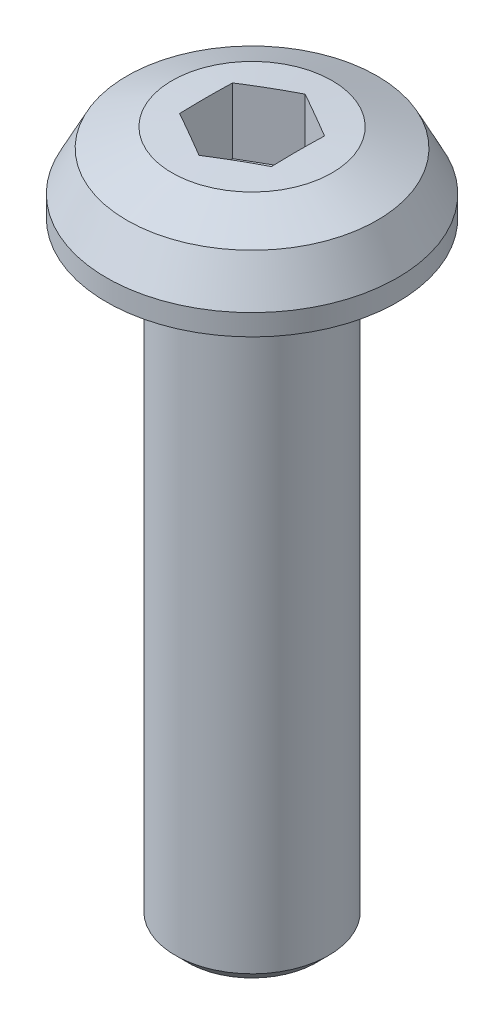
from build123d import *

# Parameters (mm, degrees)
CUT_EXTRUDE1_DEPTH = 2.25


with BuildPart() as part:
    # Sketch1 → Revolve1 (revolve)
    with BuildSketch(Plane.XY):
        Polygon((0, -20), (2.1, -20), (2.5, -19.6), (2.5, 0), (4.75, 0), (4.75, 0.6875), (4.085, 1.98), (2.6125, 2.585), (0, 2.75), align=None)
    revolve(axis=Axis((0, -10, 0), (0, 1, 0)))

    # Sketch2 → Cut-Extrude1 (cut)
    with BuildSketch(Plane(origin=(0, 2.75, 0), x_dir=(1, 0, 0), z_dir=(0, 1, 0))):
        Polygon((1.5, -0.866025404), (0, -1.732050808), (-1.5, -0.866025404), (-1.5, 0.866025404), (0, 1.732050808), (1.5, 0.866025404), align=None)
    extrude(amount=-CUT_EXTRUDE1_DEPTH, mode=Mode.SUBTRACT)


solid = part.part
